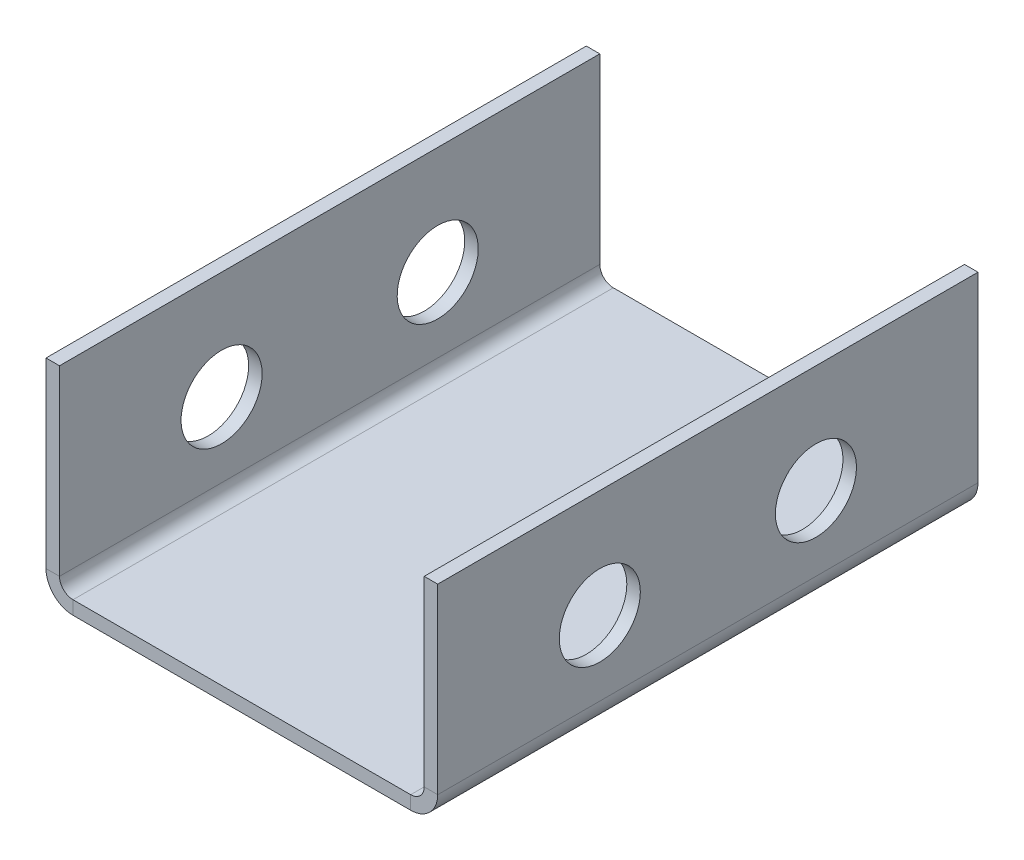
from build123d import *

# Parameters (mm, degrees)
BRIDA_BASE1_DEPTH     = 20
CROQUIS5_R            = 1.5
CORTAR_EXTRUIR1_DEPTH = 36.673932989


# Sheet-metal steps are written as plain solids
with BuildPart() as part:
    # Croquis1 → Brida base1 (new body)
    with BuildSketch(Plane.XY):
        with BuildLine():
            Line((-37.721015228, -17.986734349), (-37.721015228, -24.736734349))
            ThreePointArc((-37.721015228, -24.736734349), (-37.42812201, -25.44384113), (-36.721015228, -25.736734349))
            Line((-36.721015228, -25.736734349), (-24.221015228, -25.736734349))
            ThreePointArc((-24.221015228, -25.736734349), (-23.513908447, -25.44384113), (-23.221015228, -24.736734349))
            Line((-23.221015228, -24.736734349), (-23.221015228, -17.986734349))
            Line((-23.221015228, -17.986734349), (-23.721015228, -17.986734349))
            Line((-23.721015228, -17.986734349), (-23.721015228, -24.736734349))
            ThreePointArc((-23.721015228, -24.736734349), (-23.867461838, -25.090287739), (-24.221015228, -25.236734349))
            Line((-24.221015228, -25.236734349), (-36.721015228, -25.236734349))
            ThreePointArc((-36.721015228, -25.236734349), (-37.074568619, -25.090287739), (-37.221015228, -24.736734349))
            Line((-37.221015228, -24.736734349), (-37.221015228, -17.986734349))
            Line((-37.221015228, -17.986734349), (-37.721015228, -17.986734349))
        make_face()
    extrude(amount=BRIDA_BASE1_DEPTH)

    # Croquis5 → Cortar-Extruir1 (cut, through all)
    with BuildSketch(Plane(origin=(-23.221015228, 0, 0), x_dir=(0, 0, -1), z_dir=(1, 0, 0))):
        with Locations((-14, -21.986734349)):
            Circle(CROQUIS5_R)
        with Locations(Location((-6, -21.986734349, 0), (0, 0, 90))):
            Circle(CROQUIS5_R)
    extrude(amount=-CORTAR_EXTRUIR1_DEPTH, mode=Mode.SUBTRACT)


solid = part.part
